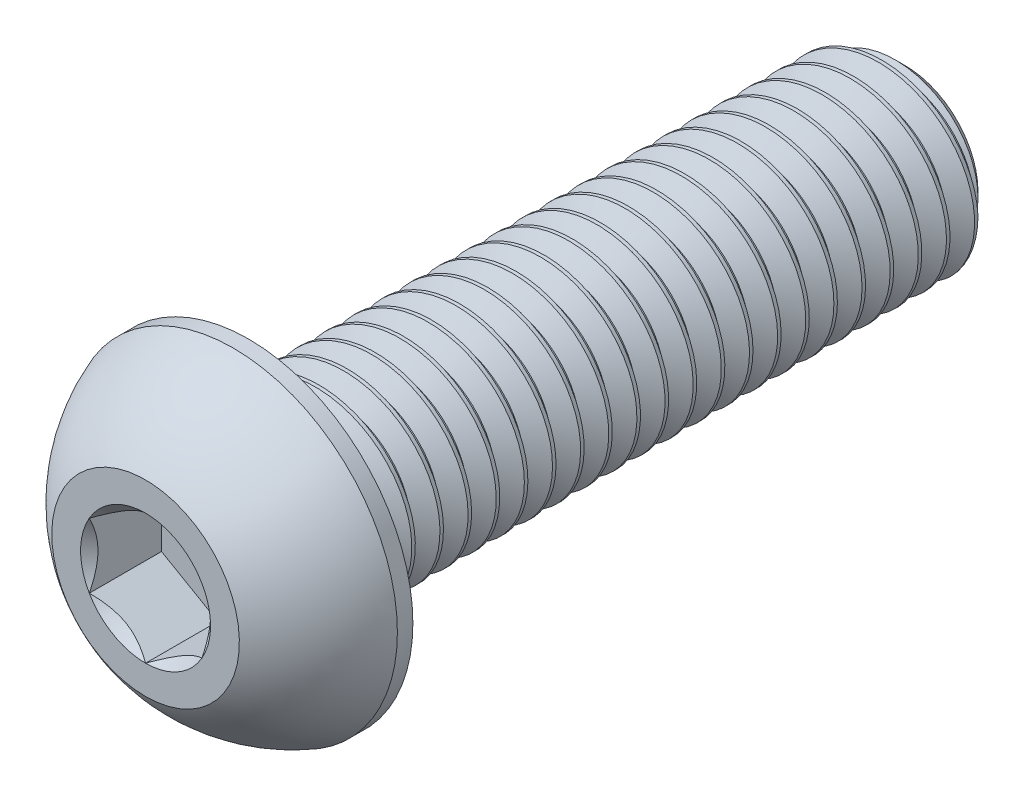
from build123d import *

# Parameters (mm, degrees)
CUT_EXTRUDE2_DEPTH = 3.85
CUT_SWEEP2_PITCH   = 1.5
CUT_SWEEP2_TO      = 35


with BuildPart() as part:
    # Sketch10 → Revolve3 (revolve)
    with BuildSketch(Plane(origin=(0, 0, 0), x_dir=(0, 0, -1), z_dir=(1, 0, 0)), mode=Mode.PRIVATE) as revolve3_sk:
        Polygon((39.375, 5), (40.5, 3.875), (40.5, 0), (5.5, 0), (5.5, 5), align=None)
    revolve(revolve3_sk.sketch.rotate(Axis((0, 0, 0), (0, 0, -1)), 90), axis=Axis((0, 0, 0), (0, 0, -1)))

    # Sketch7 → Revolve2 (revolve)
    with BuildSketch(Plane(origin=(0, 0, 0), x_dir=(0, 0, -1), z_dir=(1, 0, 0)), mode=Mode.PRIVATE) as revolve2_sk:
        with BuildLine():
            Line((4.675, 8.75), (5.5, 8.75))
            Line((5.5, 8.75), (5.5, 0))
            Line((5.5, 0), (0, 0))
            Line((0, 0), (0, 5))
            ThreePointArc((0, 5), (2.027465032, 7.26151026), (4.675, 8.75))
        make_face()
    revolve(revolve2_sk.sketch.rotate(Axis((0, 0, 0), (0, 0, -1)), 180), axis=Axis((0, 0, 0), (0, 0, -1)))

    # Sketch5 → Cut-Extrude2 (cut)
    with BuildSketch(Plane.XY):
        Polygon((3, -1.732050808), (3, 1.732050808), (0, 3.464101615), (-3, 1.732050808), (-3, -1.732050808), (0, -3.464101615), align=None)
    extrude(amount=-CUT_EXTRUDE2_DEPTH, mode=Mode.SUBTRACT)

    # Cut-Extrude3 cone 1 section (through the dimple's axis) → Cut-Extrude3 (revolve, cut)
    with BuildSketch(Plane(origin=(0, 0, 0), x_dir=(0, -1, 0), z_dir=(1, 0, 0))):
        Polygon((0, 0), (3.464101615, 0), (0, 3.464101615), align=None)
    revolve(axis=Axis((0, 0, 0), (0, 0, -1)), mode=Mode.SUBTRACT)


with BuildPart() as body_2:
    # Split1: read off the stored shape, not the designer's step
    # Split1: the piece on the far side of the plane
    add(part.part)
    split(bisect_by=Plane.XY.offset(-5.5), keep=Keep.BOTTOM)

    # Cut-Sweep2: arcs per turn and ends read off the stored shape
    # Cut-Sweep2: the profile of Sketch12 screwed along a right-hand helix through 28 turns, 8 arcs to a turn; built about Z, then put on its axis
    cut_sweep2_z = Axis((0, 0, 0), (0, 0, 1))
    cut_sweep2_corners = [(4.025721421, 0, -0.5625), (4.025721421, 0, -0.75), (5.081189882, 0, -1.359375), (5.081189882, 0, 0.046875)]
    with BuildLine(mode=Mode.PRIVATE) as cut_sweep2_profile:
        Line(cut_sweep2_corners[0], cut_sweep2_corners[1])
        Line(cut_sweep2_corners[1], cut_sweep2_corners[2])
        Line(cut_sweep2_corners[2], cut_sweep2_corners[3])
        Line(cut_sweep2_corners[3], cut_sweep2_corners[0])
    cut_sweep2_cap = Face(cut_sweep2_profile.wire())
    cut_sweep2_turn_angles = [0, 22.5, 45, 67.5, 90, 112.5, 135, 157.5, 180, 202.5, 225, 247.5, 270, 292.5, 315, 337.5, 360]
    cut_sweep2_turn_weights = [1, 0.9238795325112867, 1, 0.9238795325112867, 1, 0.9238795325112867, 1, 0.9238795325112867, 1, 0.9238795325112867, 1, 0.9238795325112867, 1, 0.9238795325112867, 1, 0.9238795325112867, 1]
    cut_sweep2_turn_rails = [Edge.make_bspline([Vector(p[0], p[1], 0).rotate(cut_sweep2_z, cut_sweep2_turn_angles[k]) / cut_sweep2_turn_weights[k] + Vector(0, 0, p[2] + CUT_SWEEP2_PITCH * cut_sweep2_turn_angles[k] / 360) for k in range(17)], [0, 0, 0, 1, 1, 2, 2, 3, 3, 4, 4, 5, 5, 6, 6, 7, 7, 8, 8, 8], 2, cut_sweep2_turn_weights) for p in cut_sweep2_corners]
    cut_sweep2_turn_sides = [Face.make_surface_from_curves(cut_sweep2_turn_rails[p[0]], cut_sweep2_turn_rails[p[1]]) for p in [(0, 1), (1, 2), (2, 3), (3, 0)]]
    cut_sweep2 = Plane(origin=(0, 0, -40.5), x_dir=(0, 1, 0), z_dir=(0, 0, 1)) * split(Solid(Shell([*[p.moved(Location((0, 0, CUT_SWEEP2_PITCH * i))) for i in range(28) for p in cut_sweep2_turn_sides], cut_sweep2_cap, cut_sweep2_cap.rotate(cut_sweep2_z, 10080).moved(Location((0, 0, CUT_SWEEP2_PITCH * 10080 / 360)))])), bisect_by=Plane.XY.offset(CUT_SWEEP2_TO), keep=Keep.BOTTOM, mode=Mode.PRIVATE)
    add(cut_sweep2, mode=Mode.SUBTRACT)


with BuildPart() as part_1:
    add(part.part)

    # Split1
    split(bisect_by=Plane.XY.offset(-5.5), keep=Keep.TOP)

    add(body_2.part)  # Boss-Extrude1 merges body 2
    # Boss-Extrude1: read off the stored shape, not the designer's step
    # Boss-Extrude1 outline → Boss-Extrude1 (revolve)
    with BuildSketch(Plane.XZ):
        Polygon((4.025721421, -5.5), (4.025721421, -6.474278579), (5, -5.5), align=None)
    revolve(axis=Axis((0, 0, 0), (0, 0, 1)))


solid = part_1.part
